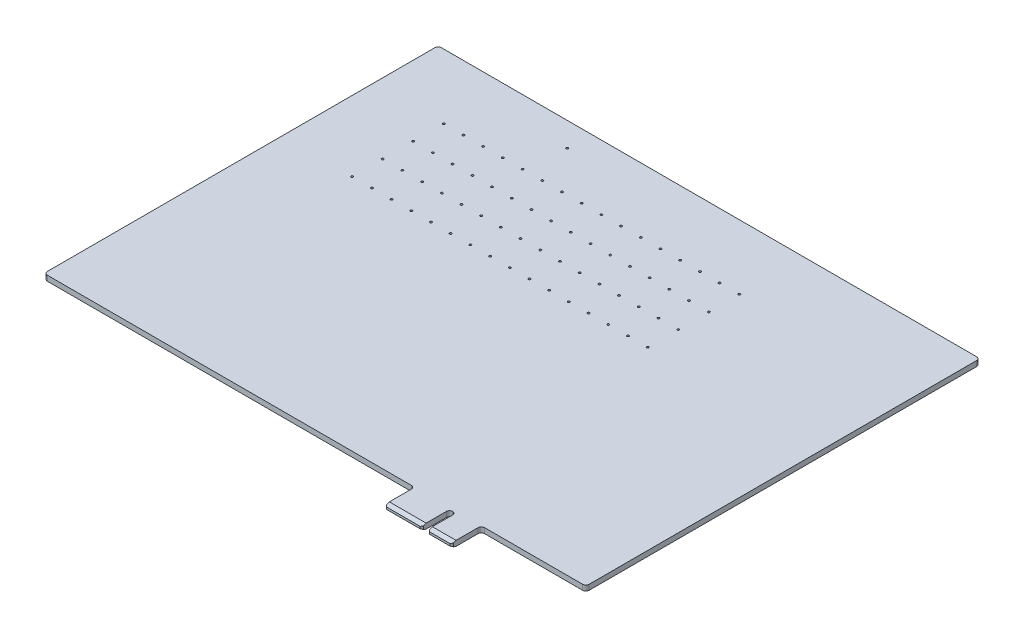
from build123d import *

# Parameters (mm, degrees)
SKETCH1_W                    = 165
SKETCH1_H                    = 129
BOSS_EXTRUDE1_DEPTH          = 1.6
SKETCH2_W                    = 112.85
SKETCH2_H                    = 9
CUT_EXTRUDE1_DEPTH           = 224.491744814
SKETCH3_W                    = 31.85
SKETCH3_H                    = 9
CUT_EXTRUDE2_DEPTH           = 224.491744814
SKETCH4_W                    = 1.9
SKETCH4_H                    = 8.41
CUT_EXTRUDE3_DEPTH           = 224.491744814
FILLET1_R                    = 1
FILLET2_R                    = 0.95
CHAMFER1_SIZE                = 0.5
F_0_65_0_65_DIAMETER_HOLE1_D = 0.65
LPATTERN1_COUNT              = 16
LPATTERN1_PITCH              = 6
LPATTERN1_COUNT_DIR2         = 4
LPATTERN1_PITCH_DIR2         = 9.302
F_0_65_0_65_DIAMETER_HOLE2_D = 0.65
CUT_EXTRUDE4_DEPTH           = 216.751152952


with BuildPart() as part:
    # Sketch1 → Boss-Extrude1 (new body)
    with BuildSketch(Plane(origin=(0, 0, 0), x_dir=(1, 0, 0), z_dir=(0, 1, 0))):
        with Locations((92.5, 74.5)):
            Rectangle(SKETCH1_W, SKETCH1_H)
    extrude(amount=BOSS_EXTRUDE1_DEPTH)

    # Sketch2 → Cut-Extrude1 (cut, through all)
    with BuildSketch(Plane(origin=(0, 1.6, 0), x_dir=(1, 0, 0), z_dir=(0, 1, 0))):
        with Locations((66.425, 14.5)):
            Rectangle(SKETCH2_W, SKETCH2_H)
    extrude(amount=-CUT_EXTRUDE1_DEPTH, mode=Mode.SUBTRACT)

    # Sketch3 → Cut-Extrude2 (cut, through all)
    with BuildSketch(Plane(origin=(0, 1.6, 0), x_dir=(1, 0, 0), z_dir=(0, 1, 0))):
        with Locations((159.075, 14.5)):
            Rectangle(SKETCH3_W, SKETCH3_H)
    extrude(amount=-CUT_EXTRUDE2_DEPTH, mode=Mode.SUBTRACT)

    # Sketch4 → Cut-Extrude3 (cut, through all)
    with BuildSketch(Plane(origin=(0, 1.6, 0), x_dir=(1, 0, 0), z_dir=(0, 1, 0))):
        with Locations((135, 14.205)):
            Rectangle(SKETCH4_W, SKETCH4_H)
    extrude(amount=-CUT_EXTRUDE3_DEPTH, mode=Mode.SUBTRACT)

    # Fillet1
    fillet1_edges = [part.edges().sort_by_distance(p)[0] for p in [
        (10, 0.8, -19),
        (122.85, 0.8, -19),
        (175, 0.8, -19),
        (143.15, 0.8, -19),
        (10, 0.8, -139),
        (175, 0.8, -139),
    ]]
    fillet(fillet1_edges, radius=FILLET1_R)

    # Fillet2
    fillet2_edges = [part.edges().sort_by_distance(p)[0] for p in [
        (135.95, 0.8, -18.41),
        (134.05, 0.8, -18.41),
    ]]
    fillet(fillet2_edges, radius=FILLET2_R - 0.0001)  # a hair under: the kernel refuses the full size

    # Chamfer1
    chamfer1_edges = [part.edges().sort_by_distance(p)[0] for p in [
        (122.85, 0.8, -10),
        (143.15, 0.8, -10),
        (135.95, 0.8, -10),
        (134.05, 0.8, -10),
    ]]
    chamfer(chamfer1_edges, length=CHAMFER1_SIZE)

    # Ø0.65 (0.65) Diameter Hole1 (through all)
    with Locations(Plane(origin=(0, 1.6, 0), x_dir=(1, 0, 0), z_dir=(0, 1, 0))):
        with Locations((31.402, 91.42)):
            f_0_65_0_65_diameter_hole1 = Hole(F_0_65_0_65_DIAMETER_HOLE1_D / 2)

    # LPattern1: 0.65 _0.65_ Diameter Hole1 16 × 4
    with Locations(*[(i * LPATTERN1_PITCH, 0, -j * LPATTERN1_PITCH_DIR2) for i in range(LPATTERN1_COUNT) for j in range(LPATTERN1_COUNT_DIR2) if (i, j) != (0, 0)]):
        add(f_0_65_0_65_diameter_hole1, mode=Mode.SUBTRACT)

    # Ø0.65 (0.65) Diameter Hole2 (through all)
    with Locations(Plane(origin=(0, 1.6, 0), x_dir=(1, 0, 0), z_dir=(0, 1, 0))):
        with Locations((56.694, 131.618)):
            Hole(F_0_65_0_65_DIAMETER_HOLE2_D / 2)

    # Sketch11 → Cut-Extrude4 (cut, through all)
    with BuildSketch(Plane(origin=(175, 0, 0), x_dir=(0, 0, -1), z_dir=(1, 0, 0))):
        Polygon((11.3, 1.6), (10, 1.126838695), (10, 1.6), align=None)
        Polygon((11.3, 0), (10, 0), (10, 0.473161305), align=None)
    extrude(amount=-CUT_EXTRUDE4_DEPTH, mode=Mode.SUBTRACT)


solid = part.part
